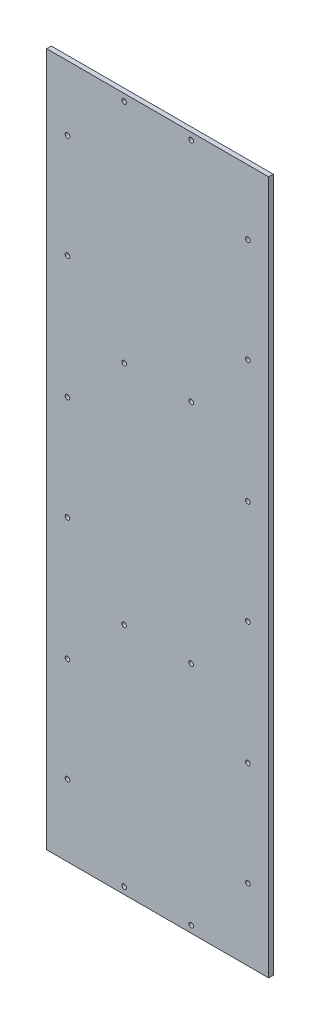
from build123d import *

# Parameters (mm, degrees)
SKETCH1_W           = 96
SKETCH1_H           = 300
BOSS_EXTRUDE1_DEPTH = 2
SKETCH2_R           = 1
CUT_EXTRUDE1_DEPTH  = 10


with BuildPart() as part:
    # Sketch1 → Boss-Extrude1 (new body)
    with BuildSketch(Plane.XY):
        Rectangle(SKETCH1_W, SKETCH1_H)
    extrude(amount=BOSS_EXTRUDE1_DEPTH)

    # Sketch2 → Cut-Extrude1 (cut)
    with BuildSketch(Plane.XY.offset(2)):
        with Locations((-39, 122)):
            Circle(SKETCH2_R)
        with Locations((-39, 77)):
            Circle(SKETCH2_R)
        with Locations((39, 122)):
            Circle(SKETCH2_R)
        with Locations((39, 77)):
            Circle(SKETCH2_R)
        with Locations((-39, 24)):
            Circle(SKETCH2_R)
        with Locations((-39, -21)):
            Circle(SKETCH2_R)
        with Locations((39, 24)):
            Circle(SKETCH2_R)
        with Locations((39, -21)):
            Circle(SKETCH2_R)
        with Locations((-39, -74)):
            Circle(SKETCH2_R)
        with Locations((-39, -119)):
            Circle(SKETCH2_R)
        with Locations((39, -74)):
            Circle(SKETCH2_R)
        with Locations((39, -119)):
            Circle(SKETCH2_R)
        with Locations((14.5, -147)):
            Circle(SKETCH2_R)
        with Locations((-14.5, -147)):
            Circle(SKETCH2_R)
        with Locations((-14.5, -49)):
            Circle(SKETCH2_R)
        with Locations((14.5, -49)):
            Circle(SKETCH2_R)
        with Locations((-14.5, 49)):
            Circle(SKETCH2_R)
        with Locations((14.5, 49)):
            Circle(SKETCH2_R)
        with Locations((-14.5, 147)):
            Circle(SKETCH2_R)
        with Locations((14.5, 147)):
            Circle(SKETCH2_R)
    extrude(amount=-CUT_EXTRUDE1_DEPTH, mode=Mode.SUBTRACT)


solid = part.part
